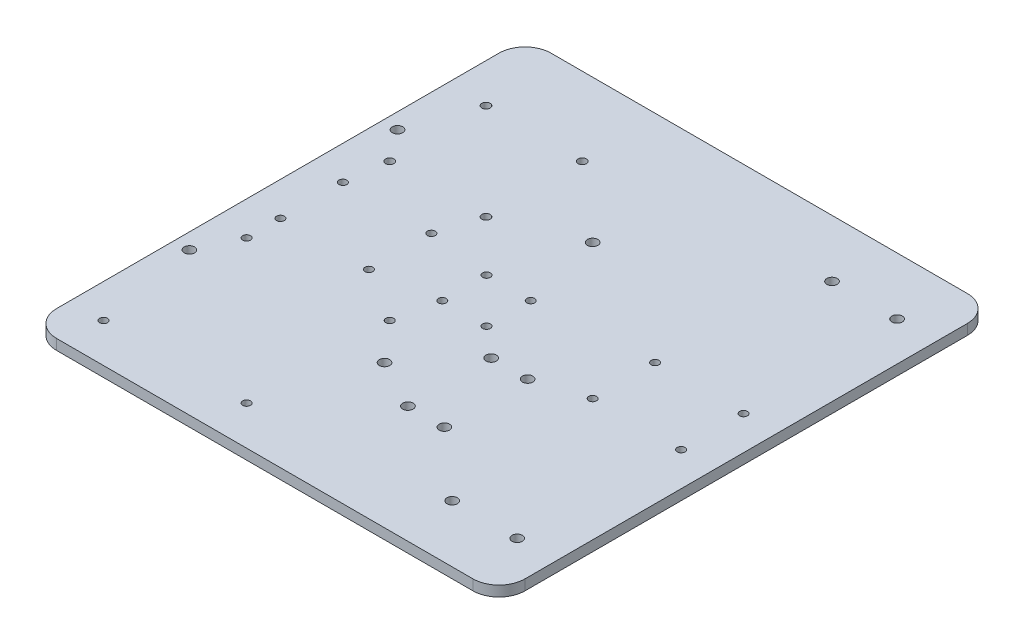
from build123d import *

# Parameters (mm, degrees)
SKETCH_1_W           = 180
SKETCH_1_H           = 190
EXTRUDE_1_DEPTH      = 4
SKETCH_4_R           = 1.6
CUT_EXTRUDE_3_DEPTH  = 4
SKETCH_5_R           = 1.5
CUT_EXTRUDE_4_DEPTH  = 4
SKETCH_7_R           = 2
CUT_EXTRUDE_5_DEPTH  = 10
SKETCH_8_R           = 1.5
CUT_EXTRUDE_6_DEPTH  = 10
SKETCH_11_R          = 1.5
CUT_EXTRUDE_8_DEPTH  = 4
SKETCH_12_R          = 2
CUT_EXTRUDE_9_DEPTH  = 4
SKETCH_15_R          = 2
CUT_EXTRUDE_10_DEPTH = 131.923641868
FILLET_2_R           = 10


with BuildPart() as part:
    # 草图1 → 凸台-拉伸1 (new body)
    with BuildSketch(Plane(origin=(0, 0, 0), x_dir=(1, 0, 0), z_dir=(0, 1, 0))):
        Rectangle(SKETCH_1_W, SKETCH_1_H)
    extrude(amount=EXTRUDE_1_DEPTH)

    # 草图4 → 切除-拉伸3 (cut)
    with BuildSketch(Plane(origin=(0, 4, 0), x_dir=(1, 0, 0), z_dir=(0, 1, 0))):
        with Locations((-75, 65)):
            Circle(SKETCH_4_R)
        with Locations((-38, 65)):
            Circle(SKETCH_4_R)
        with Locations((-38, 28)):
            Circle(SKETCH_4_R)
        with Locations((-75, 28)):
            Circle(SKETCH_4_R)
    extrude(amount=-CUT_EXTRUDE_3_DEPTH, mode=Mode.SUBTRACT)

    # 草图5 → 切除-拉伸4 (cut)
    with BuildSketch(Plane(origin=(0, 4, 0), x_dir=(1, 0, 0), z_dir=(0, 1, 0))):
        with Locations((-77, -80)):
            Circle(SKETCH_5_R)
        with Locations((-77, -25)):
            Circle(SKETCH_5_R)
        with Locations((-22, -25)):
            Circle(SKETCH_5_R)
        with Locations((-22, -80)):
            Circle(SKETCH_5_R)
    extrude(amount=-CUT_EXTRUDE_4_DEPTH, mode=Mode.SUBTRACT)

    # 草图7 → 切除-拉伸5 (cut)
    with BuildSketch(Plane.XZ):
        with Locations((24, 50)):
            Circle(SKETCH_7_R)
        with Locations((10, 50)):
            Circle(SKETCH_7_R)
        with Locations((24, 18)):
            Circle(SKETCH_7_R)
        with Locations((10, 18)):
            Circle(SKETCH_7_R)
    extrude(amount=-CUT_EXTRUDE_5_DEPTH, mode=Mode.SUBTRACT)

    # 草图8 → 切除-拉伸6 (cut)
    with BuildSketch(Plane.XZ):
        with Locations((-18.5, 8.3)):
            Circle(SKETCH_8_R)
        with Locations((-1.5, 8.3)):
            Circle(SKETCH_8_R)
        with Locations((-18.5, -8.7)):
            Circle(SKETCH_8_R)
        with Locations((-1.5, -8.7)):
            Circle(SKETCH_8_R)
    extrude(amount=-CUT_EXTRUDE_6_DEPTH, mode=Mode.SUBTRACT)

    # 草图11 → 切除-拉伸8 (cut)
    with BuildSketch(Plane.XZ):
        with Locations((77, 12)):
            Circle(SKETCH_11_R)
        with Locations((43, 12)):
            Circle(SKETCH_11_R)
        with Locations((77, -12)):
            Circle(SKETCH_11_R)
        with Locations((43, -12)):
            Circle(SKETCH_11_R)
    cut_extrude_8 = extrude(amount=-CUT_EXTRUDE_8_DEPTH, mode=Mode.SUBTRACT)

    # 草图12 → 切除-拉伸9 (cut)
    with BuildSketch(Plane.XZ):
        with Locations((-84, 40)):
            Circle(SKETCH_12_R)
        with Locations((-9, 40)):
            Circle(SKETCH_12_R)
        with Locations((-9, -40)):
            Circle(SKETCH_12_R)
        with Locations((-84, -40)):
            Circle(SKETCH_12_R)
    extrude(amount=-CUT_EXTRUDE_9_DEPTH, mode=Mode.SUBTRACT)

    # 草图15 → 切除-拉伸10 (cut, through all)
    with BuildSketch(Plane(origin=(0, 4, 0), x_dir=(1, 0, 0), z_dir=(0, 1, 0))):
        with Locations((75, -73)):
            Circle(SKETCH_15_R)
        with Locations((50, -73)):
            Circle(SKETCH_15_R)
    cut_extrude_10 = extrude(amount=-CUT_EXTRUDE_10_DEPTH, mode=Mode.SUBTRACT)

    # 镜向2: 切除-拉伸10 across plane
    add(cut_extrude_10.mirror(Plane.XY), mode=Mode.SUBTRACT)

    # 圆角2
    fillet_2_edges = [part.edges().sort_by_distance(p)[0] for p in [
        (-90, 2, 95),
        (90, 2, 95),
        (90, 2, -95),
        (-90, 2, -95),
    ]]
    fillet(fillet_2_edges, radius=FILLET_2_R)

    # 镜向3: 切除-拉伸8 across plane
    add(cut_extrude_8.mirror(Plane(origin=(0, 0, 0), x_dir=(0, 0, 1), z_dir=(1, 0, 0))), mode=Mode.SUBTRACT)


solid = part.part
